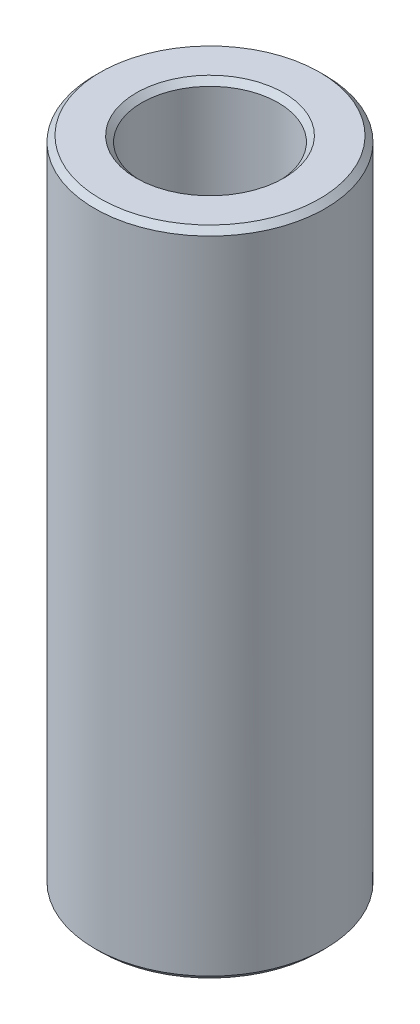
from build123d import *

# Parameters (mm, degrees)
SKETCH1_R           = 37.5
BOSS_EXTRUDE1_DEPTH = 212.130577539
SKETCH2_R           = 22.186508857
CUT_EXTRUDE1_DEPTH  = 219.659282737
CHAMFER1_SIZE       = 1.836331044


with BuildPart() as part:
    # Sketch1 → Boss-Extrude1 (new body)
    with BuildSketch(Plane(origin=(0, 0, 0), x_dir=(1, 0, 0), z_dir=(0, 1, 0))):
        Circle(SKETCH1_R)
    extrude(amount=BOSS_EXTRUDE1_DEPTH)

    # Sketch2 → Cut-Extrude1 (cut, through all)
    with BuildSketch(Plane(origin=(0, 0, 0), x_dir=(1, 0, 0), z_dir=(0, 1, 0))):
        Circle(SKETCH2_R)
    extrude(amount=CUT_EXTRUDE1_DEPTH, mode=Mode.SUBTRACT)

    # Chamfer1
    chamfer1_edges = [part.edges().sort_by_distance(p)[0] for p in [
        (-22.186508857, 212.130577539, 0),
        (-22.186508857, 0, 0),
        (-37.5, 0, 0),
        (-37.5, 212.130577539, 0),
    ]]
    chamfer(chamfer1_edges, length=CHAMFER1_SIZE)


solid = part.part
